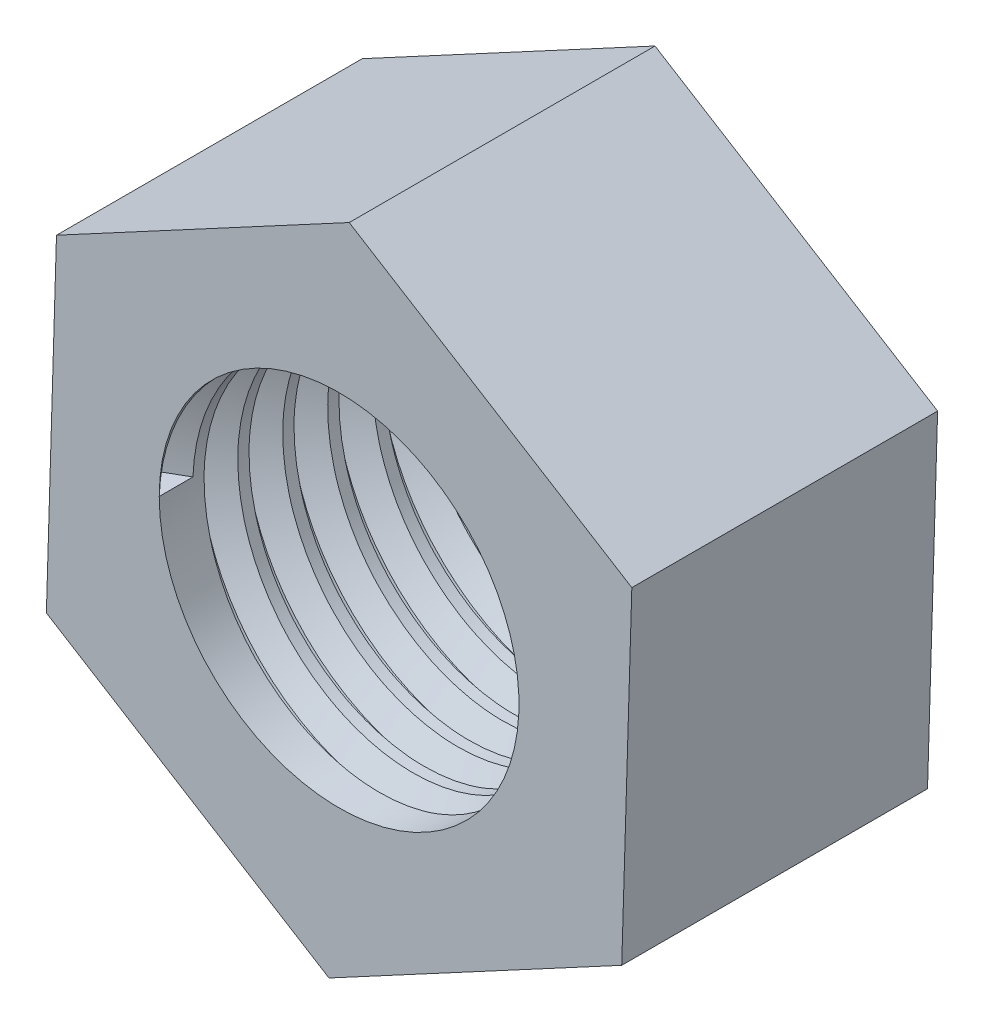
from build123d import *

# Parameters (mm, degrees)
BOSS_EXTRUDE1_DEPTH = 6.8
SKETCH2_R           = 4
CUT_EXTRUDE1_DEPTH  = 12.965613746
THREAD1_PITCH       = 1


with BuildPart() as part:
    # Sketch1 → Boss-Extrude1 (new body)
    with BuildSketch(Plane.XY):
        Polygon((6.284608137, -3.888063), (6.509465398, 3.4985988), (0.224857261, 7.3866618), (-6.284608137, 3.888063), (-6.509465398, -3.4985988), (-0.224857261, -7.3866618), align=None)
    extrude(amount=BOSS_EXTRUDE1_DEPTH)

    # Sketch2 → Cut-Extrude1 (cut, through all)
    with BuildSketch(Plane.XY.offset(6.8)):
        Circle(SKETCH2_R)
    extrude(amount=-CUT_EXTRUDE1_DEPTH, mode=Mode.SUBTRACT)

    # Thread1: the profile of Thread Profile1 profile screwed along a right-hand helix of 6.8 turns, 8 arcs to a turn; built about Z, then put on its axis
    thread1_z = Axis((0, 0, 0), (0, 0, 1))
    thread1_corners = [(3.9997, 0, -0.000173205), (4.541265875, 0, 0.312499999), (4.541265875, 0, 0.437499999), (3.9997, 0, 0.750173202)]
    with BuildLine(mode=Mode.PRIVATE) as thread1_profile:
        Line(thread1_corners[0], thread1_corners[1])
        Line(thread1_corners[1], thread1_corners[2])
        Line(thread1_corners[2], thread1_corners[3])
        Line(thread1_corners[3], thread1_corners[0])
    thread1_cap = Face(thread1_profile.wire())
    thread1_turn_angles = [0, 22.5, 45, 67.5, 90, 112.5, 135, 157.5, 180, 202.5, 225, 247.5, 270, 292.5, 315, 337.5, 360]
    thread1_turn_weights = [1, 0.9238795325112867, 1, 0.9238795325112867, 1, 0.9238795325112867, 1, 0.9238795325112867, 1, 0.9238795325112867, 1, 0.9238795325112867, 1, 0.9238795325112867, 1, 0.9238795325112867, 1]
    thread1_turn_rails = [Edge.make_bspline([Vector(p[0], p[1], 0).rotate(thread1_z, thread1_turn_angles[k]) / thread1_turn_weights[k] + Vector(0, 0, p[2] + THREAD1_PITCH * thread1_turn_angles[k] / 360) for k in range(17)], [0, 0, 0, 1, 1, 2, 2, 3, 3, 4, 4, 5, 5, 6, 6, 7, 7, 8, 8, 8], 2, thread1_turn_weights) for p in thread1_corners]
    thread1_turn_sides = [Face.make_surface_from_curves(thread1_turn_rails[p[0]], thread1_turn_rails[p[1]]) for p in [(0, 1), (1, 2), (2, 3), (3, 0)]]
    thread1_last_angles = [2160, 2182.5, 2205, 2227.5, 2250, 2272.5, 2295, 2317.5, 2340, 2362.5, 2385, 2407.5, 2430, 2439, 2448]
    thread1_last_weights = [1, 0.9238795325112867, 1, 0.9238795325112867, 1, 0.9238795325112867, 1, 0.9238795325112867, 1, 0.9238795325112867, 1, 0.9238795325112867, 1, 0.9876883405951378, 1]
    thread1_last_rails = [Edge.make_bspline([Vector(p[0], p[1], 0).rotate(thread1_z, thread1_last_angles[k]) / thread1_last_weights[k] + Vector(0, 0, p[2] + THREAD1_PITCH * thread1_last_angles[k] / 360) for k in range(15)], [0, 0, 0, 1, 1, 2, 2, 3, 3, 4, 4, 5, 5, 6, 6, 7, 7, 7], 2, thread1_last_weights) for p in thread1_corners]
    thread1_last_sides = [Face.make_surface_from_curves(thread1_last_rails[p[0]], thread1_last_rails[p[1]]) for p in [(0, 1), (1, 2), (2, 3), (3, 0)]]
    thread1 = Plane(origin=(0, 0, 6.8), x_dir=(-1, 0, 0), z_dir=(0, 0, -1)) * Solid(Shell([*[p.moved(Location((0, 0, THREAD1_PITCH * i))) for i in range(6) for p in thread1_turn_sides], *thread1_last_sides, thread1_cap, thread1_cap.rotate(thread1_z, 2448).moved(Location((0, 0, THREAD1_PITCH * 2448 / 360)))]))
    add(thread1, mode=Mode.SUBTRACT)


solid = part.part
